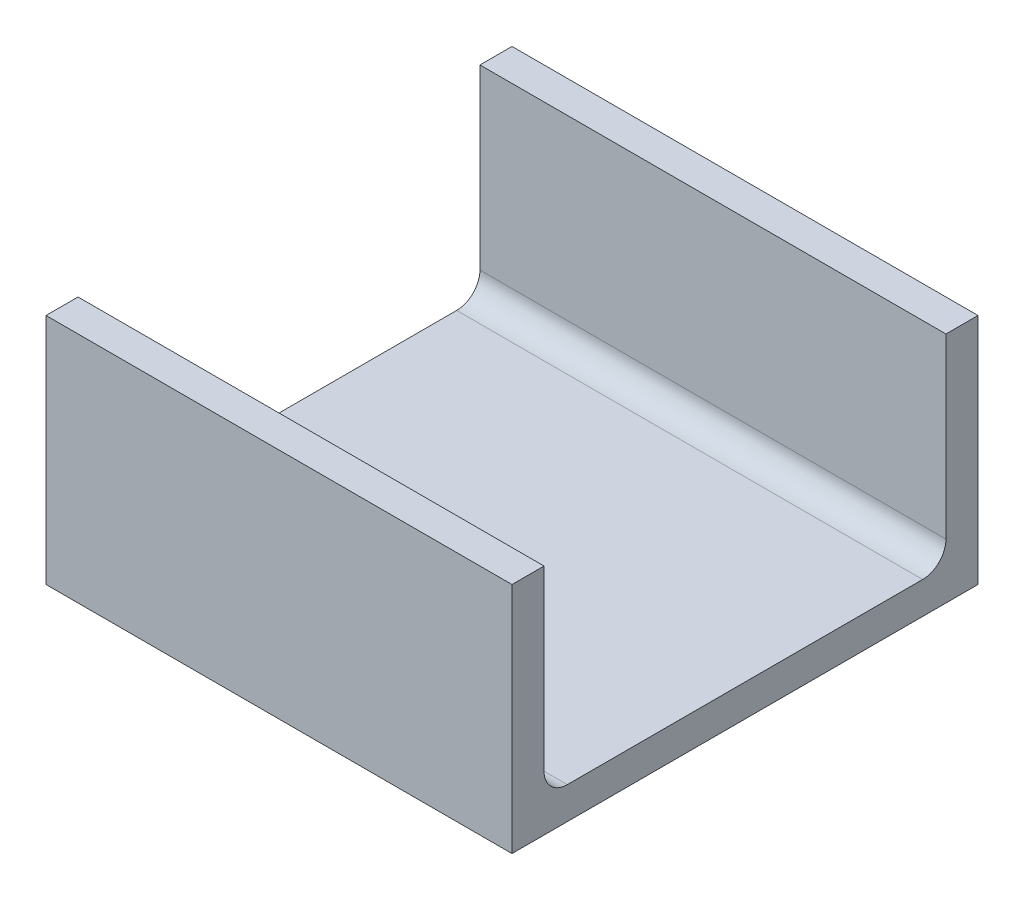
from build123d import *

# Parameters (mm, degrees)
BOSS_EXTRUDE1_DEPTH = 50.8


with BuildPart() as part:
    # Sketch1 → Boss-Extrude1 (new body)
    with BuildSketch(Plane(origin=(0, 0, 0), x_dir=(0, 0, -1), z_dir=(1, 0, 0))):
        with BuildLine():
            Line((-21.9075, -6.6675), (-21.9075, 9.2075))
            Line((-21.9075, 9.2075), (-21.9075, 12.7))
            Line((-21.9075, 12.7), (-25.4, 12.7))
            Line((-25.4, 12.7), (-25.4, -12.7))
            Line((-25.4, -12.7), (25.4, -12.7))
            Line((25.4, -12.7), (25.4, 12.7))
            Line((25.4, 12.7), (21.9075, 12.7))
            Line((21.9075, 12.7), (21.9075, 9.2075))
            Line((21.9075, 9.2075), (21.9075, -6.6675))
            ThreePointArc((21.9075, -6.6675), (21.163551224, -8.463551224), (19.3675, -9.2075))
            Line((19.3675, -9.2075), (-19.3675, -9.2075))
            ThreePointArc((-19.3675, -9.2075), (-21.163551224, -8.463551224), (-21.9075, -6.6675))
        make_face()
    extrude(amount=BOSS_EXTRUDE1_DEPTH)


solid = part.part
